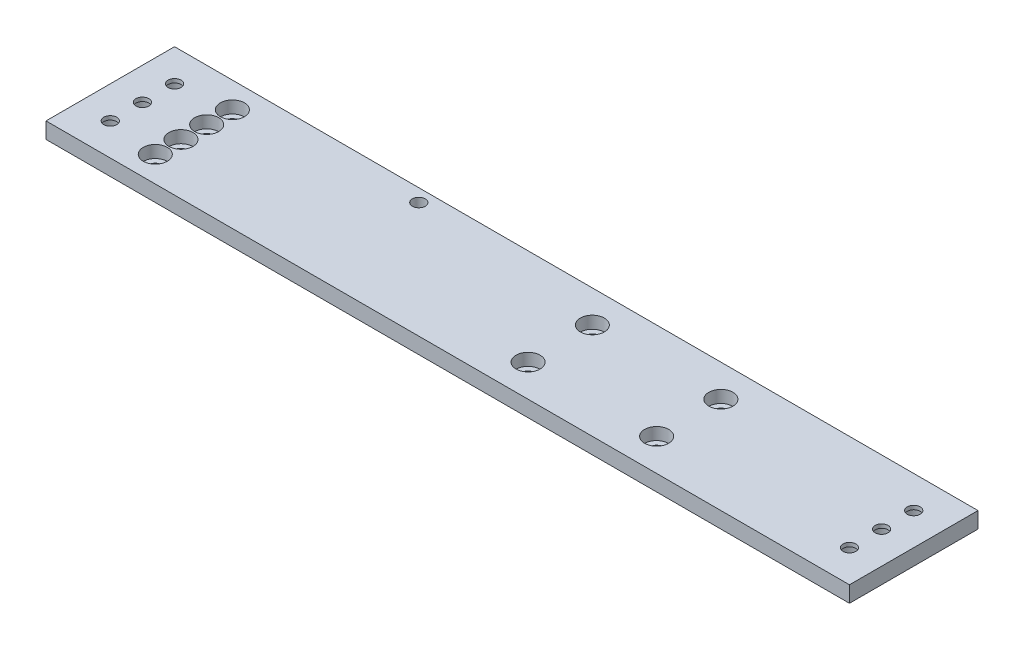
from build123d import *

# Parameters (mm, degrees)
SKETCH1_W                                       = 317.5
SKETCH1_H                                       = 50.8
BOSS_EXTRUDE1_DEPTH                             = 6.35
CBORE_FOR_10_SOCKET_HEAD_CAP_SCREW1_D           = 5.1054
CBORE_FOR_10_SOCKET_HEAD_CAP_SCREW1_CBORE_D     = 9.525
CBORE_FOR_10_SOCKET_HEAD_CAP_SCREW1_CBORE_DEPTH = 4.826
CBORE_FOR_10_SOCKET_HEAD_CAP_SCREW2_D           = 5.1054
CBORE_FOR_10_SOCKET_HEAD_CAP_SCREW2_CBORE_D     = 9.525
CBORE_FOR_10_SOCKET_HEAD_CAP_SCREW2_CBORE_DEPTH = 4.826
F_1_4_20_TAPPED_HOLE1_OUTLINE_R                 = 2.5527
F_1_4_20_TAPPED_HOLE1_DEPTH                     = 6.35


# Read off the part's stored shape, not the designer's step: 1/4-20 Tapped Hole1
with BuildPart() as part:
    # Sketch1 → Boss-Extrude1 (new body)
    with BuildSketch(Plane(origin=(0, 0, 0), x_dir=(1, 0, 0), z_dir=(0, 1, 0))):
        Rectangle(SKETCH1_W, SKETCH1_H)
    extrude(amount=BOSS_EXTRUDE1_DEPTH)

    # CBORE for #10 Socket Head Cap Screw1 (through all)
    with Locations(Plane(origin=(0, 6.35, 0), x_dir=(1, 0, 0), z_dir=(0, 1, 0))):
        with Locations((-125.73, -5.08), (19.05, 12.7), (69.85, 12.7), (19.05, -12.7), (69.85, -12.7), (-125.73, 15.24), (-125.73, 5.08), (-125.73, -15.24)):
            CounterBoreHole(CBORE_FOR_10_SOCKET_HEAD_CAP_SCREW1_D / 2, CBORE_FOR_10_SOCKET_HEAD_CAP_SCREW1_CBORE_D / 2, CBORE_FOR_10_SOCKET_HEAD_CAP_SCREW1_CBORE_DEPTH)

    # CBORE for #10 Socket Head Cap Screw2 (through all)
    with Locations(Plane.XZ):
        with Locations((-146.05, 12.7), (-146.05, 0), (-146.05, -12.7), (146.05, 12.7), (146.05, 0), (146.05, -12.7)):
            CounterBoreHole(CBORE_FOR_10_SOCKET_HEAD_CAP_SCREW2_D / 2, CBORE_FOR_10_SOCKET_HEAD_CAP_SCREW2_CBORE_D / 2, CBORE_FOR_10_SOCKET_HEAD_CAP_SCREW2_CBORE_DEPTH)

    # 1/4-20 Tapped Hole1 outline → 1/4-20 Tapped Hole1 (cut)
    with BuildSketch(Plane(origin=(0, 0, 0), x_dir=(1, 0, 0), z_dir=(0, 1, 0))):
        with Locations((-57.15, 20.32)):
            Circle(F_1_4_20_TAPPED_HOLE1_OUTLINE_R)
    extrude(amount=F_1_4_20_TAPPED_HOLE1_DEPTH, mode=Mode.SUBTRACT)


solid = part.part
